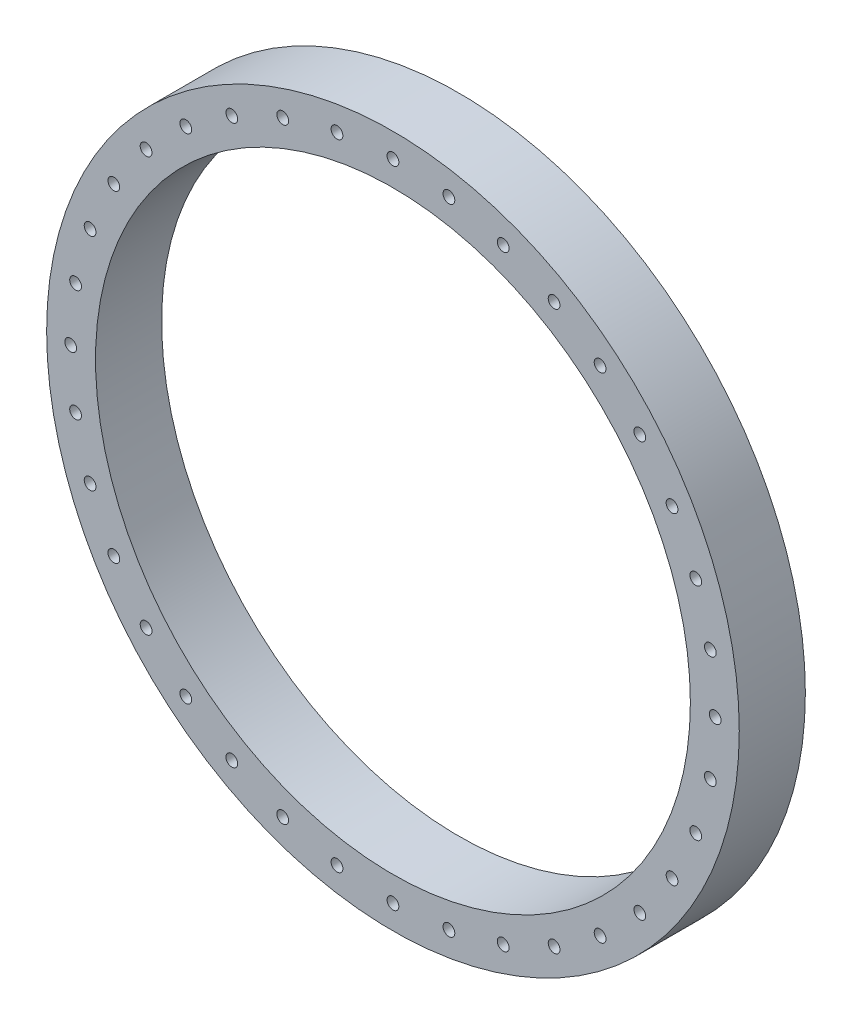
from build123d import *

# Parameters (mm, degrees)
SKETCH1_R                   = 66.548
SKETCH1_R_2                 = 57.15
SKETCH1_R_3                 = 1.1303
BOSS_EXTRUDE1_DEPTH         = 12.7
BODY_MOVE_COPY1_START       = -12.7
BODY_MOVE_COPY1_OUTLINE_R   = 1.1303
BODY_MOVE_COPY1_DEPTH       = 12.7
BODY_MOVE_COPY1_2_OUTLINE_R = 1.1303
BODY_MOVE_COPY1_2_DEPTH     = 12.7


# Read off the part's stored shape, not the designer's step: Body-Move/Copy1
with BuildPart() as part:
    # Sketch1 → Boss-Extrude1 (new body)
    with BuildSketch(Plane.XY):
        Circle(SKETCH1_R)
        Circle(SKETCH1_R_2, mode=Mode.SUBTRACT)
        with Locations((0, 61.9252)):
            Circle(SKETCH1_R_3, mode=Mode.SUBTRACT)
        with Locations((10.753198132, 60.984417067)):
            Circle(SKETCH1_R_3, mode=Mode.SUBTRACT)
        with Locations((21.179665779, 58.190653481)):
            Circle(SKETCH1_R_3, mode=Mode.SUBTRACT)
        with Locations((30.9626, 53.628796334)):
            Circle(SKETCH1_R_3, mode=Mode.SUBTRACT)
        with Locations((39.804751287, 47.437455349)):
            Circle(SKETCH1_R_3, mode=Mode.SUBTRACT)
        with Locations((47.437455349, 39.804751287)):
            Circle(SKETCH1_R_3, mode=Mode.SUBTRACT)
        with Locations((53.628796334, 30.9626)):
            Circle(SKETCH1_R_3, mode=Mode.SUBTRACT)
        with Locations((58.190653481, 21.179665779)):
            Circle(SKETCH1_R_3, mode=Mode.SUBTRACT)
        with Locations((60.984417067, 10.753198132)):
            Circle(SKETCH1_R_3, mode=Mode.SUBTRACT)
        with Locations((61.9252, 0)):
            Circle(SKETCH1_R_3, mode=Mode.SUBTRACT)
        with Locations((60.984417067, -10.753198132)):
            Circle(SKETCH1_R_3, mode=Mode.SUBTRACT)
        with Locations((58.190653481, -21.179665779)):
            Circle(SKETCH1_R_3, mode=Mode.SUBTRACT)
        with Locations((53.628796334, -30.9626)):
            Circle(SKETCH1_R_3, mode=Mode.SUBTRACT)
        with Locations((47.437455349, -39.804751287)):
            Circle(SKETCH1_R_3, mode=Mode.SUBTRACT)
        with Locations((39.804751287, -47.437455349)):
            Circle(SKETCH1_R_3, mode=Mode.SUBTRACT)
        with Locations((30.9626, -53.628796334)):
            Circle(SKETCH1_R_3, mode=Mode.SUBTRACT)
        with Locations((21.179665779, -58.190653481)):
            Circle(SKETCH1_R_3, mode=Mode.SUBTRACT)
        with Locations((10.753198132, -60.984417067)):
            Circle(SKETCH1_R_3, mode=Mode.SUBTRACT)
        with Locations((0, -61.9252)):
            Circle(SKETCH1_R_3, mode=Mode.SUBTRACT)
        with Locations((-10.753198132, -60.984417067)):
            Circle(SKETCH1_R_3, mode=Mode.SUBTRACT)
        with Locations((-21.179665779, -58.190653481)):
            Circle(SKETCH1_R_3, mode=Mode.SUBTRACT)
        with Locations((-30.9626, -53.628796334)):
            Circle(SKETCH1_R_3, mode=Mode.SUBTRACT)
        with Locations((-39.804751287, -47.437455349)):
            Circle(SKETCH1_R_3, mode=Mode.SUBTRACT)
        with Locations((-47.437455349, -39.804751287)):
            Circle(SKETCH1_R_3, mode=Mode.SUBTRACT)
        with Locations((-53.628796334, -30.9626)):
            Circle(SKETCH1_R_3, mode=Mode.SUBTRACT)
        with Locations((-58.190653481, -21.179665779)):
            Circle(SKETCH1_R_3, mode=Mode.SUBTRACT)
        with Locations((-60.984417067, -10.753198132)):
            Circle(SKETCH1_R_3, mode=Mode.SUBTRACT)
        with Locations((-61.9252, 0)):
            Circle(SKETCH1_R_3, mode=Mode.SUBTRACT)
        with Locations((-60.984417067, 10.753198132)):
            Circle(SKETCH1_R_3, mode=Mode.SUBTRACT)
        with Locations((-58.190653481, 21.179665779)):
            Circle(SKETCH1_R_3, mode=Mode.SUBTRACT)
        with Locations((-53.628796334, 30.9626)):
            Circle(SKETCH1_R_3, mode=Mode.SUBTRACT)
        with Locations((-47.437455349, 39.804751287)):
            Circle(SKETCH1_R_3, mode=Mode.SUBTRACT)
        with Locations((-39.804751287, 47.437455349)):
            Circle(SKETCH1_R_3, mode=Mode.SUBTRACT)
        with Locations((-30.9626, 53.628796334)):
            Circle(SKETCH1_R_3, mode=Mode.SUBTRACT)
        with Locations((-21.179665779, 58.190653481)):
            Circle(SKETCH1_R_3, mode=Mode.SUBTRACT)
        with Locations((-10.753198132, 60.984417067)):
            Circle(SKETCH1_R_3, mode=Mode.SUBTRACT)
    extrude(amount=-BOSS_EXTRUDE1_DEPTH)

    # Body-Move/Copy1 outline → Body-Move/Copy1 (cut)
    # profile 1 of 4: a face of its own
    with BuildSketch(Plane.XY.offset(BODY_MOVE_COPY1_START)):
        with BuildLine():
            ThreePointArc((-51.613279002, 24.539599237), (-54.79707391, 28.786683882), (-57.632258571, 33.274))
            ThreePointArc((-57.632258571, 33.274), (0, -66.548), (57.632258571, 33.274))
            ThreePointArc((57.632258571, 33.274), (54.79707391, 28.786683882), (51.613279002, 24.539599237))
            ThreePointArc((51.613279002, 24.539599237), (0, -57.15), (-51.613279002, 24.539599237))
        make_face()
        with Locations((-39.804751287, -47.437455349)):
            Circle(BODY_MOVE_COPY1_OUTLINE_R, mode=Mode.SUBTRACT)
        with Locations((-53.628796334, -30.9626)):
            Circle(BODY_MOVE_COPY1_OUTLINE_R, mode=Mode.SUBTRACT)
        with Locations((-58.190653481, -21.179665779)):
            Circle(BODY_MOVE_COPY1_OUTLINE_R, mode=Mode.SUBTRACT)
        with Locations((-47.437455349, -39.804751287)):
            Circle(BODY_MOVE_COPY1_OUTLINE_R, mode=Mode.SUBTRACT)
        with Locations((-21.179665779, -58.190653481)):
            Circle(BODY_MOVE_COPY1_OUTLINE_R, mode=Mode.SUBTRACT)
        with Locations((-30.9626, -53.628796334)):
            Circle(BODY_MOVE_COPY1_OUTLINE_R, mode=Mode.SUBTRACT)
        with Locations((-10.753198132, -60.984417067)):
            Circle(BODY_MOVE_COPY1_OUTLINE_R, mode=Mode.SUBTRACT)
        with Locations((-60.984417067, -10.753198132)):
            Circle(BODY_MOVE_COPY1_OUTLINE_R, mode=Mode.SUBTRACT)
        with Locations((-61.9252, 0)):
            Circle(BODY_MOVE_COPY1_OUTLINE_R, mode=Mode.SUBTRACT)
        with Locations((-60.984417067, 10.753198132)):
            Circle(BODY_MOVE_COPY1_OUTLINE_R, mode=Mode.SUBTRACT)
        with Locations((-58.190653481, 21.179665779)):
            Circle(BODY_MOVE_COPY1_OUTLINE_R, mode=Mode.SUBTRACT)
        with Locations((0, -61.9252)):
            Circle(BODY_MOVE_COPY1_OUTLINE_R, mode=Mode.SUBTRACT)
        with Locations((10.753198132, -60.984417067)):
            Circle(BODY_MOVE_COPY1_OUTLINE_R, mode=Mode.SUBTRACT)
        with Locations((21.179665779, -58.190653481)):
            Circle(BODY_MOVE_COPY1_OUTLINE_R, mode=Mode.SUBTRACT)
        with Locations((30.9626, -53.628796334)):
            Circle(BODY_MOVE_COPY1_OUTLINE_R, mode=Mode.SUBTRACT)
        with Locations((39.804751287, -47.437455349)):
            Circle(BODY_MOVE_COPY1_OUTLINE_R, mode=Mode.SUBTRACT)
        with Locations((47.437455349, -39.804751287)):
            Circle(BODY_MOVE_COPY1_OUTLINE_R, mode=Mode.SUBTRACT)
        with Locations((53.628796334, -30.9626)):
            Circle(BODY_MOVE_COPY1_OUTLINE_R, mode=Mode.SUBTRACT)
        with Locations((58.190653481, -21.179665779)):
            Circle(BODY_MOVE_COPY1_OUTLINE_R, mode=Mode.SUBTRACT)
        with Locations((60.984417067, -10.753198132)):
            Circle(BODY_MOVE_COPY1_OUTLINE_R, mode=Mode.SUBTRACT)
        with Locations((61.9252, 0)):
            Circle(BODY_MOVE_COPY1_OUTLINE_R, mode=Mode.SUBTRACT)
        with Locations((60.984417067, 10.753198132)):
            Circle(BODY_MOVE_COPY1_OUTLINE_R, mode=Mode.SUBTRACT)
        with Locations((58.190653481, 21.179665779)):
            Circle(BODY_MOVE_COPY1_OUTLINE_R, mode=Mode.SUBTRACT)
    # profile 2 of 4: a face of its own
    with BuildSketch(Plane.XY.offset(BODY_MOVE_COPY1_START)):
        with BuildLine():
            ThreePointArc((51.613279002, 42.008400763), (0, 66.548), (-51.613279002, 42.008400763))
            ThreePointArc((-51.613279002, 42.008400763), (-49.23304107, 37.526797975), (-46.464647034, 33.274))
            ThreePointArc((-46.464647034, 33.274), (0, 57.15), (46.464647034, 33.274))
            ThreePointArc((46.464647034, 33.274), (49.23304107, 37.526797975), (51.613279002, 42.008400763))
        make_face()
        with Locations((-47.437455349, 39.804751287)):
            Circle(BODY_MOVE_COPY1_OUTLINE_R, mode=Mode.SUBTRACT)
        with Locations((-39.804751287, 47.437455349)):
            Circle(BODY_MOVE_COPY1_OUTLINE_R, mode=Mode.SUBTRACT)
        with Locations((-30.9626, 53.628796334)):
            Circle(BODY_MOVE_COPY1_OUTLINE_R, mode=Mode.SUBTRACT)
        with Locations((-21.179665779, 58.190653481)):
            Circle(BODY_MOVE_COPY1_OUTLINE_R, mode=Mode.SUBTRACT)
        with Locations((-10.753198132, 60.984417067)):
            Circle(BODY_MOVE_COPY1_OUTLINE_R, mode=Mode.SUBTRACT)
        with Locations((21.179665779, 58.190653481)):
            Circle(BODY_MOVE_COPY1_OUTLINE_R, mode=Mode.SUBTRACT)
        with Locations((30.9626, 53.628796334)):
            Circle(BODY_MOVE_COPY1_OUTLINE_R, mode=Mode.SUBTRACT)
        with Locations((0, 61.9252)):
            Circle(BODY_MOVE_COPY1_OUTLINE_R, mode=Mode.SUBTRACT)
        with Locations((10.753198132, 60.984417067)):
            Circle(BODY_MOVE_COPY1_OUTLINE_R, mode=Mode.SUBTRACT)
        with Locations((47.437455349, 39.804751287)):
            Circle(BODY_MOVE_COPY1_OUTLINE_R, mode=Mode.SUBTRACT)
        with Locations((39.804751287, 47.437455349)):
            Circle(BODY_MOVE_COPY1_OUTLINE_R, mode=Mode.SUBTRACT)
    # profile 3 of 4: a face of its own
    with BuildSketch(Plane.XY.offset(BODY_MOVE_COPY1_START)):
        with Locations((53.628796334, 35.5854)):
            Circle(BODY_MOVE_COPY1_OUTLINE_R)
    # profile 4 of 4: a face of its own
    with BuildSketch(Plane.XY.offset(BODY_MOVE_COPY1_START)):
        with Locations((-53.628796334, 35.5854)):
            Circle(BODY_MOVE_COPY1_OUTLINE_R)
    extrude(amount=BODY_MOVE_COPY1_DEPTH, mode=Mode.SUBTRACT)

    # Body-Move_Copy1 2 outline → Body-Move_Copy1 2 (add)
    # profile 1 of 4: a face of its own
    with BuildSketch(Plane.XY.offset(BODY_MOVE_COPY1_START)):
        with BuildLine():
            ThreePointArc((57.632258571, 33.274), (0, 133.096), (-57.632258571, 33.274))
            ThreePointArc((-57.632258571, 33.274), (-54.79707391, 37.761316118), (-51.613279002, 42.008400763))
            ThreePointArc((-51.613279002, 42.008400763), (0, 123.698), (51.613279002, 42.008400763))
            ThreePointArc((51.613279002, 42.008400763), (54.79707391, 37.761316118), (57.632258571, 33.274))
        make_face()
        with Locations((-58.190653481, 45.368334221)):
            Circle(BODY_MOVE_COPY1_2_OUTLINE_R, mode=Mode.SUBTRACT)
        with Locations((-60.984417067, 55.794801868)):
            Circle(BODY_MOVE_COPY1_2_OUTLINE_R, mode=Mode.SUBTRACT)
        with Locations((-61.9252, 66.548)):
            Circle(BODY_MOVE_COPY1_2_OUTLINE_R, mode=Mode.SUBTRACT)
        with Locations((-60.984417067, 77.301198132)):
            Circle(BODY_MOVE_COPY1_2_OUTLINE_R, mode=Mode.SUBTRACT)
        with Locations((-58.190653481, 87.727665779)):
            Circle(BODY_MOVE_COPY1_2_OUTLINE_R, mode=Mode.SUBTRACT)
        with Locations((-53.628796334, 97.5106)):
            Circle(BODY_MOVE_COPY1_2_OUTLINE_R, mode=Mode.SUBTRACT)
        with Locations((-47.437455349, 106.352751287)):
            Circle(BODY_MOVE_COPY1_2_OUTLINE_R, mode=Mode.SUBTRACT)
        with Locations((-39.804751287, 113.985455349)):
            Circle(BODY_MOVE_COPY1_2_OUTLINE_R, mode=Mode.SUBTRACT)
        with Locations((-30.9626, 120.176796334)):
            Circle(BODY_MOVE_COPY1_2_OUTLINE_R, mode=Mode.SUBTRACT)
        with Locations((-21.179665779, 124.738653481)):
            Circle(BODY_MOVE_COPY1_2_OUTLINE_R, mode=Mode.SUBTRACT)
        with Locations((-10.753198132, 127.532417067)):
            Circle(BODY_MOVE_COPY1_2_OUTLINE_R, mode=Mode.SUBTRACT)
        with Locations((58.190653481, 45.368334221)):
            Circle(BODY_MOVE_COPY1_2_OUTLINE_R, mode=Mode.SUBTRACT)
        with Locations((60.984417067, 55.794801868)):
            Circle(BODY_MOVE_COPY1_2_OUTLINE_R, mode=Mode.SUBTRACT)
        with Locations((61.9252, 66.548)):
            Circle(BODY_MOVE_COPY1_2_OUTLINE_R, mode=Mode.SUBTRACT)
        with Locations((60.984417067, 77.301198132)):
            Circle(BODY_MOVE_COPY1_2_OUTLINE_R, mode=Mode.SUBTRACT)
        with Locations((0, 128.4732)):
            Circle(BODY_MOVE_COPY1_2_OUTLINE_R, mode=Mode.SUBTRACT)
        with Locations((10.753198132, 127.532417067)):
            Circle(BODY_MOVE_COPY1_2_OUTLINE_R, mode=Mode.SUBTRACT)
        with Locations((30.9626, 120.176796334)):
            Circle(BODY_MOVE_COPY1_2_OUTLINE_R, mode=Mode.SUBTRACT)
        with Locations((21.179665779, 124.738653481)):
            Circle(BODY_MOVE_COPY1_2_OUTLINE_R, mode=Mode.SUBTRACT)
        with Locations((47.437455349, 106.352751287)):
            Circle(BODY_MOVE_COPY1_2_OUTLINE_R, mode=Mode.SUBTRACT)
        with Locations((58.190653481, 87.727665779)):
            Circle(BODY_MOVE_COPY1_2_OUTLINE_R, mode=Mode.SUBTRACT)
        with Locations((53.628796334, 97.5106)):
            Circle(BODY_MOVE_COPY1_2_OUTLINE_R, mode=Mode.SUBTRACT)
        with Locations((39.804751287, 113.985455349)):
            Circle(BODY_MOVE_COPY1_2_OUTLINE_R, mode=Mode.SUBTRACT)
    # profile 2 of 4: a face of its own
    with BuildSketch(Plane.XY.offset(BODY_MOVE_COPY1_START)):
        with BuildLine():
            ThreePointArc((-46.464647034, 33.274), (-49.23304107, 29.021202025), (-51.613279002, 24.539599237))
            ThreePointArc((-51.613279002, 24.539599237), (0, 0), (51.613279002, 24.539599237))
            ThreePointArc((51.613279002, 24.539599237), (49.23304107, 29.021202025), (46.464647034, 33.274))
            ThreePointArc((46.464647034, 33.274), (0, 9.398), (-46.464647034, 33.274))
        make_face()
        with Locations((-39.804751287, 19.110544651)):
            Circle(BODY_MOVE_COPY1_2_OUTLINE_R, mode=Mode.SUBTRACT)
        with Locations((-47.437455349, 26.743248713)):
            Circle(BODY_MOVE_COPY1_2_OUTLINE_R, mode=Mode.SUBTRACT)
        with Locations((-10.753198132, 5.563582933)):
            Circle(BODY_MOVE_COPY1_2_OUTLINE_R, mode=Mode.SUBTRACT)
        with Locations((-30.9626, 12.919203666)):
            Circle(BODY_MOVE_COPY1_2_OUTLINE_R, mode=Mode.SUBTRACT)
        with Locations((-21.179665779, 8.357346519)):
            Circle(BODY_MOVE_COPY1_2_OUTLINE_R, mode=Mode.SUBTRACT)
        with Locations((0, 4.6228)):
            Circle(BODY_MOVE_COPY1_2_OUTLINE_R, mode=Mode.SUBTRACT)
        with Locations((10.753198132, 5.563582933)):
            Circle(BODY_MOVE_COPY1_2_OUTLINE_R, mode=Mode.SUBTRACT)
        with Locations((21.179665779, 8.357346519)):
            Circle(BODY_MOVE_COPY1_2_OUTLINE_R, mode=Mode.SUBTRACT)
        with Locations((30.9626, 12.919203666)):
            Circle(BODY_MOVE_COPY1_2_OUTLINE_R, mode=Mode.SUBTRACT)
        with Locations((39.804751287, 19.110544651)):
            Circle(BODY_MOVE_COPY1_2_OUTLINE_R, mode=Mode.SUBTRACT)
        with Locations((47.437455349, 26.743248713)):
            Circle(BODY_MOVE_COPY1_2_OUTLINE_R, mode=Mode.SUBTRACT)
    # profile 3 of 4: a face of its own
    with BuildSketch(Plane.XY.offset(BODY_MOVE_COPY1_START)):
        with Locations((53.628796334, 30.9626)):
            Circle(BODY_MOVE_COPY1_2_OUTLINE_R)
    # profile 4 of 4: a face of its own
    with BuildSketch(Plane.XY.offset(BODY_MOVE_COPY1_START)):
        with Locations((-53.628796334, 30.9626)):
            Circle(BODY_MOVE_COPY1_2_OUTLINE_R)
    extrude(amount=BODY_MOVE_COPY1_2_DEPTH)


solid = part.part
